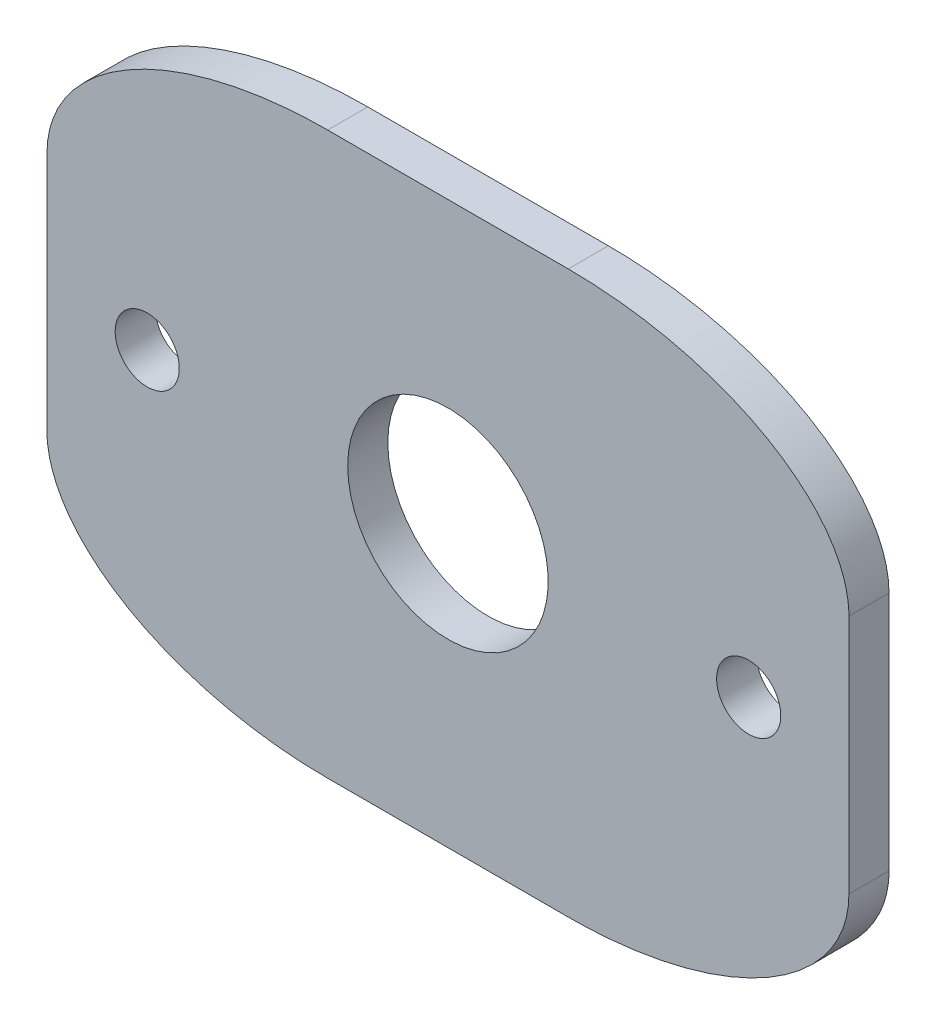
from build123d import *

# Parameters (mm, degrees)
SZKIC1_W                    = 40
SZKIC1_H                    = 28
DODANIE_WYCI_GNI_CIE1_DEPTH = 2
ZAOKR_GLENIE1_SIZE          = 14
ZAOKR_GLENIE1_SIZE_2        = 8
SZKIC3_R                    = 1.6
SZKIC3_R_2                  = 5
WYTNIJ_WYCI_GNI_CIE1_DEPTH  = 29.653097735


with BuildPart() as part:
    # Szkic1 → Dodanie-wyciągnięcie1 (new body)
    with BuildSketch(Plane.XY):
        Rectangle(SZKIC1_W, SZKIC1_H)
    extrude(amount=DODANIE_WYCI_GNI_CIE1_DEPTH)

    # Zaokrąglenie1
    # an asymmetric fillet: 14, 8 mm, written as the material it takes off along each edge
    with BuildSketch(Plane(origin=(-20, 14, -35), x_dir=(1, 0, 0), z_dir=(0, 0, 1)), Plane(origin=(20, -14, -35), x_dir=(-1, 0, 0), z_dir=(0, 0, 1))) as zaokr_glenie1_piece_1:
        with BuildLine():
            Bezier((ZAOKR_GLENIE1_SIZE, 0), (0, 0), (0, -ZAOKR_GLENIE1_SIZE_2), weights=[1, 0.707106781, 1])
            Line((0, -ZAOKR_GLENIE1_SIZE_2), (0, 0))
            Line((0, 0), (ZAOKR_GLENIE1_SIZE, 0))
        make_face()
    extrude(amount=72, mode=Mode.SUBTRACT)
    with BuildSketch(Plane(origin=(-20, -14, -35), x_dir=(1, 0, 0), z_dir=(0, 0, 1))) as zaokr_glenie1_piece_2:
        with BuildLine():
            Bezier((ZAOKR_GLENIE1_SIZE, 0), (0, 0), (0, ZAOKR_GLENIE1_SIZE_2), weights=[1, 0.707106781, 1])
            Line((0, ZAOKR_GLENIE1_SIZE_2), (0, 0))
            Line((0, 0), (ZAOKR_GLENIE1_SIZE, 0))
        make_face()
    extrude(amount=72, mode=Mode.SUBTRACT)
    with BuildSketch(Plane(origin=(20, 14, -35), x_dir=(0, -1, 0), z_dir=(0, 0, 1))) as zaokr_glenie1_piece_3:
        with BuildLine():
            Bezier((ZAOKR_GLENIE1_SIZE_2, 0), (0, 0), (0, -ZAOKR_GLENIE1_SIZE), weights=[1, 0.707106781, 1])
            Line((0, -ZAOKR_GLENIE1_SIZE), (0, 0))
            Line((0, 0), (ZAOKR_GLENIE1_SIZE_2, 0))
        make_face()
    extrude(amount=72, mode=Mode.SUBTRACT)

    # Szkic3 → Wytnij-wyciągnięcie1 (cut, through all)
    with BuildSketch(Plane.XY.offset(15)):
        with Locations(Location((-15, -1e-09, 0), (0, 0, 180))):
            Circle(SZKIC3_R)
        with Locations(Location((15, -1e-09, 0), (0, 0, 180))):
            Circle(SZKIC3_R)
        with Locations(Location((0, 0, 0), (0, 0, 180))):
            Circle(SZKIC3_R_2)
    extrude(amount=-WYTNIJ_WYCI_GNI_CIE1_DEPTH, mode=Mode.SUBTRACT)


solid = part.part
